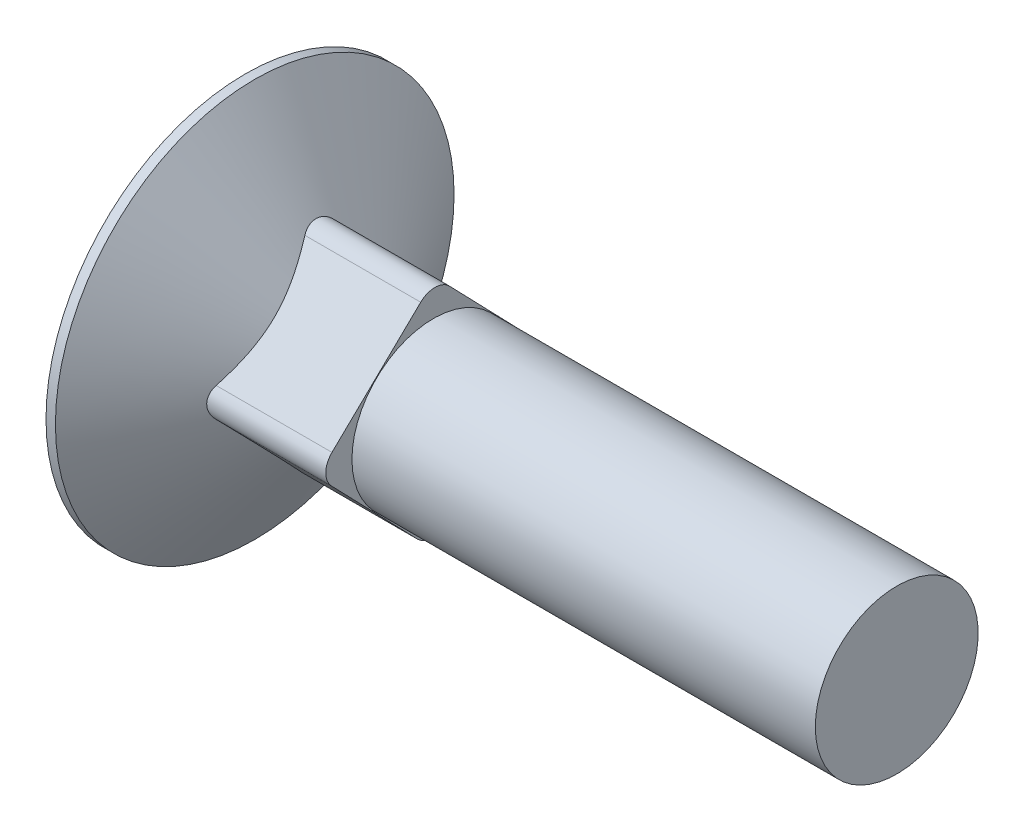
from build123d import *

# Parameters (mm, degrees)
NECK_DEPTH = 10.9982


# Read off the part's stored shape, not the designer's step: Cut-Revolve1
with BuildPart() as part:
    # Cut-Revolve1 outline → Cut-Revolve1 (revolve)
    with BuildSketch(Plane.YX):
        Polygon((0, 38.1), (0, 0), (11.6586, 0), (11.6586, 0.550820297), (4.7625, 5.0292), (4.7625, 38.1), align=None)
    revolve(axis=Axis((0, 0, 0), (1, 0, 0)))

    # Sketch2 → Neck (add)
    with BuildSketch(Plane(origin=(0, 0, 0), x_dir=(0, 0.6946583704589985, -0.7193398003386501), z_dir=(1, 0, 0))):
        with BuildLine():
            Line((3.6068, -4.8006), (-3.6068, -4.8006))
            ThreePointArc((-3.6068, -4.8006), (-4.450944075, -4.450944075), (-4.8006, -3.6068))
            Line((-4.8006, -3.6068), (-4.8006, 3.6068))
            ThreePointArc((-4.8006, 3.6068), (-4.450944075, 4.450944075), (-3.6068, 4.8006))
            Line((-3.6068, 4.8006), (3.6068, 4.8006))
            ThreePointArc((3.6068, 4.8006), (4.450944075, 4.450944075), (4.8006, 3.6068))
            Line((4.8006, 3.6068), (4.8006, -3.6068))
            ThreePointArc((4.8006, -3.6068), (4.450944075, -4.450944075), (3.6068, -4.8006))
        make_face()
    extrude(amount=NECK_DEPTH)


solid = part.part
